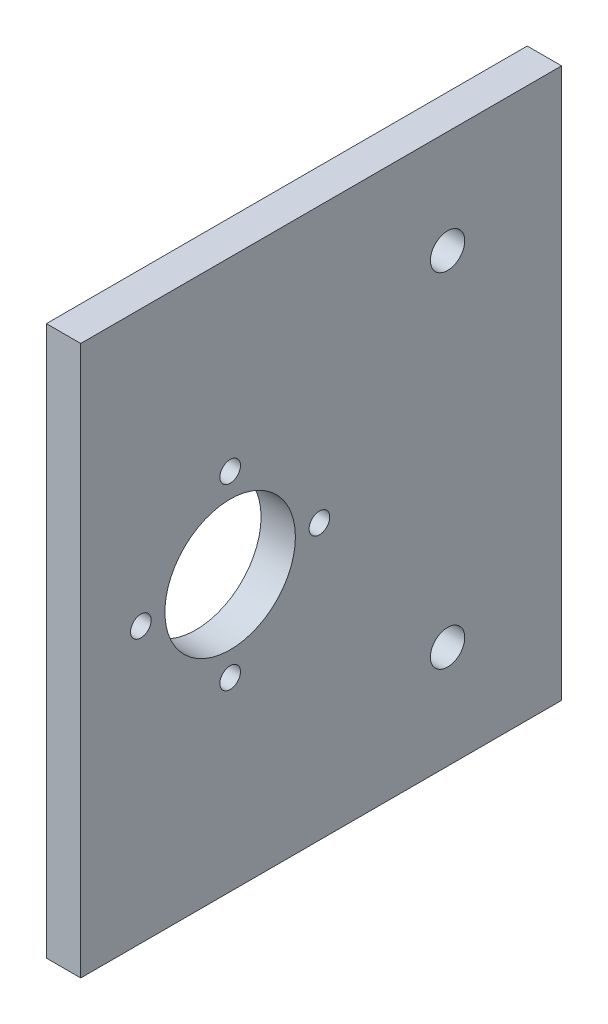
from build123d import *

# Parameters (mm, degrees)
SKETCH1_W           = 80
SKETCH1_H           = 70
SKETCH1_R           = 1.5
SKETCH1_R_2         = 9.5
SKETCH1_R_3         = 2.5
BOSS_EXTRUDE1_DEPTH = 5


with BuildPart() as part:
    # Sketch1 → Boss-Extrude1 (new body)
    with BuildSketch(Plane.YZ):
        Rectangle(SKETCH1_W, SKETCH1_H)
        with Locations((0, 26.25)):
            Circle(SKETCH1_R, mode=Mode.SUBTRACT)
        with Locations((0, 0.25)):
            Circle(SKETCH1_R, mode=Mode.SUBTRACT)
        with Locations((-13, 13.25)):
            Circle(SKETCH1_R, mode=Mode.SUBTRACT)
        with Locations((13, 13.25)):
            Circle(SKETCH1_R, mode=Mode.SUBTRACT)
        with Locations((0, 13.25)):
            Circle(SKETCH1_R_2, mode=Mode.SUBTRACT)
        with Locations((-25, -18.4)):
            Circle(SKETCH1_R_3, mode=Mode.SUBTRACT)
        with Locations((25, -18.4)):
            Circle(SKETCH1_R_3, mode=Mode.SUBTRACT)
    extrude(amount=BOSS_EXTRUDE1_DEPTH)


solid = part.part
